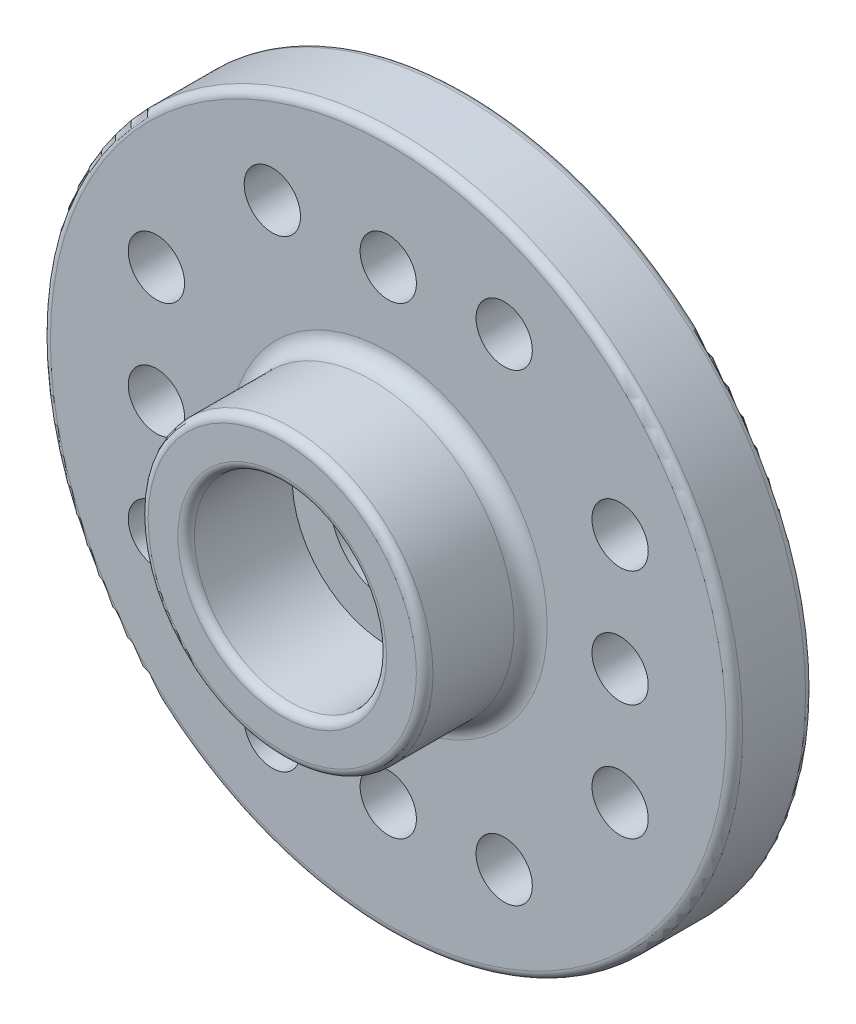
from build123d import *

# Parameters (mm, degrees)
SKETCH1_R           = 10.45
SKETCH1_R_2         = 1.75
BOSS_EXTRUDE1_DEPTH = 2.4
SKETCH2_R           = 4.3
SKETCH2_R_2         = 2.9
BOSS_EXTRUDE2_DEPTH = 3.2
SKETCH4_R           = 3.6
SKETCH4_R_2         = 3.3
BOSS_EXTRUDE3_DEPTH = 0.2
CUT_EXTRUDE2_START  = -0.4
SKETCH5_R           = 4
SKETCH5_R_2         = 3.6
SKETCH5_R_3         = 3.3
CUT_EXTRUDE2_DEPTH  = 0.4
SKETCH6_R           = 0.85
CUT_EXTRUDE3_DEPTH  = 16.803955201
CIRPATTERN1_COUNT   = 4
FILLET1_R           = 0.25
FILLET2_R           = 0.5


with BuildPart() as part:
    # Sketch1 → Boss-Extrude1 (new body)
    with BuildSketch(Plane.XY):
        Circle(SKETCH1_R)
        Circle(SKETCH1_R_2, mode=Mode.SUBTRACT)
    extrude(amount=BOSS_EXTRUDE1_DEPTH)

    # Sketch2 → Boss-Extrude2 (add)
    with BuildSketch(Plane.XY.offset(2.4)):
        Circle(SKETCH2_R)
        Circle(SKETCH2_R_2, mode=Mode.SUBTRACT)
    extrude(amount=BOSS_EXTRUDE2_DEPTH)

    # Sketch4 → Boss-Extrude3 (add)
    with BuildSketch(Plane(origin=(0, 0, 0), x_dir=(-1, 0, 0), z_dir=(0, 0, -1))):
        Circle(SKETCH4_R)
        Circle(SKETCH4_R_2, mode=Mode.SUBTRACT)
    extrude(amount=BOSS_EXTRUDE3_DEPTH)

    # Sketch5 → Cut-Extrude2 (cut)
    # profile 1 of 2: a face of its own
    with BuildSketch(Plane(origin=(0, 0, 0), x_dir=(-1, 0, 0), z_dir=(0, 0, -1)).offset(CUT_EXTRUDE2_START)):
        Circle(SKETCH5_R)
        Circle(SKETCH5_R_2, mode=Mode.SUBTRACT)
    # profile 2 of 2: a face of its own
    with BuildSketch(Plane(origin=(0, 0, 0), x_dir=(-1, 0, 0), z_dir=(0, 0, -1)).offset(CUT_EXTRUDE2_START)):
        Circle(SKETCH5_R_3)
    extrude(amount=CUT_EXTRUDE2_DEPTH, mode=Mode.SUBTRACT)

    # Sketch6 → Cut-Extrude3 (cut, through all)
    with BuildSketch(Plane(origin=(0, 0, 0), x_dir=(-1, 0, 0), z_dir=(0, 0, -1))):
        with Locations((0, 7)):
            Circle(SKETCH6_R)
        with Locations((3.5, 7)):
            Circle(SKETCH6_R)
        with Locations((-3.5, 7)):
            Circle(SKETCH6_R)
    cut_extrude3 = extrude(amount=-CUT_EXTRUDE3_DEPTH, mode=Mode.SUBTRACT)

    # CirPattern1: Cut-Extrude3 ×4 about axis
    cirpattern1_axis = Axis((0, 0, 2.4), (0, 0, -1))
    for i in range(1, CIRPATTERN1_COUNT):
        add(cut_extrude3.rotate(cirpattern1_axis, i * 360 / CIRPATTERN1_COUNT), mode=Mode.SUBTRACT)

    # Fillet1
    fillet1_edges = [part.edges().sort_by_distance(p)[0] for p in [
        (-4.3, 0, 5.6),
        (-10.45, 0, 2.4),
        (-10.45, 0, 0),
        (-2.9, 0, 5.6),
    ]]
    fillet(fillet1_edges, radius=FILLET1_R)

    # Fillet2
    fillet2_edges = [part.edges().sort_by_distance(p)[0] for p in [
        (-4.3, 0, 2.4),
    ]]
    fillet(fillet2_edges, radius=FILLET2_R)


solid = part.part
